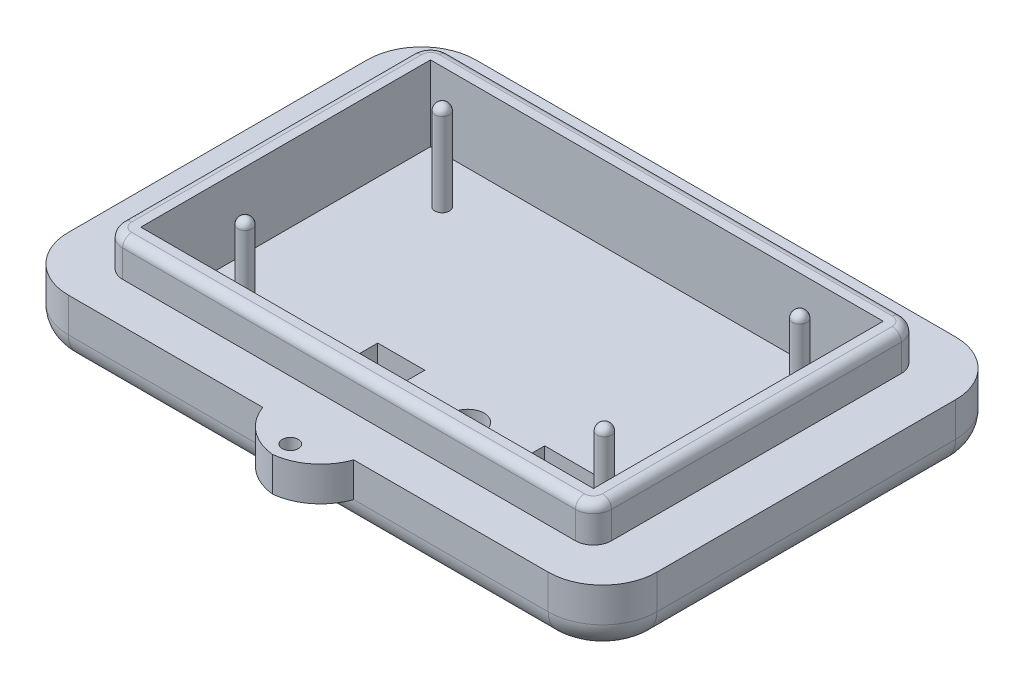
from build123d import *

# Parameters (mm, degrees)
SKETCH1_W                       = 82.55
SKETCH1_H                       = 57.15
BOSS_EXTRUDE1_DEPTH             = 8.636
FILLET2_R                       = 7.62
FILLET3_R                       = 3.81
SKETCH2_W                       = 63.5
SKETCH2_H                       = 40.64
CUT_EXTRUDE1_DEPTH              = 5.461
SKETCH7_W                       = 68.58
SKETCH7_H                       = 45.72
BOSS_EXTRUDE3_DEPTH             = 5.08
SKETCH8_W                       = 63.5
SKETCH8_H                       = 40.64
CUT_EXTRUDE3_DEPTH              = 5.08
SKETCH5_R                       = 1.016
BOSS_EXTRUDE4_DEPTH             = 12.7
SKETCH4_R                       = 2.25
SKETCH4_W                       = 12.6
SKETCH4_H                       = 5
SKETCH4_W_2                     = 6.604
SKETCH4_H_2                     = 6.604
CUT_EXTRUDE2_DEPTH              = 7.366
FILLET7_R                       = 1.016
FILLET8_R                       = 2.54
SKETCH9_W                       = 12.753817634
SKETCH9_H                       = 4.826
BOSS_EXTRUDE5_DEPTH             = 5.08
FILLET10_R                      = 7.62
FILLET11_R                      = 1.27
FILLET12_R                      = 1.016
F_4_40_TAPPED_HOLE2_D           = 2.2606
F_4_40_TAPPED_HOLE2_DEPTH       = 7.62
F_4_40_TAPPED_HOLE2_CSINK_D     = 4.1148
F_4_40_TAPPED_HOLE2_CSINK_ANGLE = 100
F_4_40_TAPPED_HOLE2_TIP         = 0.679152758


with BuildPart() as part:
    # Sketch1 → Boss-Extrude1 (new body)
    with BuildSketch(Plane(origin=(0, 0, 0), x_dir=(1, 0, 0), z_dir=(0, 1, 0))):
        with Locations((41.275, 28.575)):
            Rectangle(SKETCH1_W, SKETCH1_H)
    extrude(amount=BOSS_EXTRUDE1_DEPTH)

    # Fillet2
    fillet2_edges = [part.edges().sort_by_distance(p)[0] for p in [
        (0, 4.318, -57.15),
        (82.55, 4.318, -57.15),
        (82.55, 4.318, 0),
        (0, 4.318, 0),
    ]]
    fillet(fillet2_edges, radius=FILLET2_R)

    # Fillet3
    fillet3_edges = [part.edges().sort_by_distance(p)[0] for p in [
        (41.275, 0, -57.15),
        (0, 0, -28.575),
        (82.55, 0, -28.575),
        (41.275, 0, 0),
        (2.231846327, 0, -54.918153673),
        (2.231846327, 0, -2.231846327),
        (80.318153673, 0, -2.231846327),
        (80.318153673, 0, -54.918153673),
    ]]
    fillet(fillet3_edges, radius=FILLET3_R)

    # Sketch2 → Cut-Extrude1 (cut)
    with BuildSketch(Plane(origin=(0, 8.636, 0), x_dir=(1, 0, 0), z_dir=(0, 1, 0))):
        with Locations((41.275, 28.575)):
            Rectangle(SKETCH2_W, SKETCH2_H)
    extrude(amount=-CUT_EXTRUDE1_DEPTH, mode=Mode.SUBTRACT)

    # Sketch7 → Boss-Extrude3 (add)
    with BuildSketch(Plane(origin=(0, 8.636, 0), x_dir=(1, 0, 0), z_dir=(0, 1, 0))):
        with Locations((41.275, 28.575)):
            Rectangle(SKETCH7_W, SKETCH7_H)
    extrude(amount=BOSS_EXTRUDE3_DEPTH)

    # Sketch8 → Cut-Extrude3 (cut)
    with BuildSketch(Plane(origin=(0, 13.716, 0), x_dir=(1, 0, 0), z_dir=(0, 1, 0))):
        with Locations((41.275, 28.575)):
            Rectangle(SKETCH8_W, SKETCH8_H)
    extrude(amount=-CUT_EXTRUDE3_DEPTH, mode=Mode.SUBTRACT)

    # Sketch5 → Boss-Extrude4 (add)
    with BuildSketch(Plane(origin=(0, 3.175, 0), x_dir=(1, 0, 0), z_dir=(0, 1, 0))):
        with Locations(Location((17.665, 42.392, 0), (0, 0, 90))):
            Circle(SKETCH5_R)
        with Locations(Location((17.665, 14.732, 0), (0, 0, 90))):
            Circle(SKETCH5_R)
        with Locations(Location((67.945, 42.259, 0), (0, 0, 90))):
            Circle(SKETCH5_R)
        with Locations(Location((67.945, 14.859, 0), (0, 0, 90))):
            Circle(SKETCH5_R)
    extrude(amount=BOSS_EXTRUDE4_DEPTH)

    # Sketch4 → Cut-Extrude2 (cut)
    with BuildSketch(Plane(origin=(0, 3.175, 0), x_dir=(1, 0, 0), z_dir=(0, 1, 0))):
        with Locations(Location((45.641, 18.034, 0), (0, 0, 270))):
            Circle(SKETCH4_R)
        with Locations((60.171, 18.059)):
            Rectangle(SKETCH4_W, SKETCH4_H)
        with Locations((32.983, 18.034)):
            Rectangle(SKETCH4_W_2, SKETCH4_H_2)
    extrude(amount=-CUT_EXTRUDE2_DEPTH, mode=Mode.SUBTRACT)

    # Fillet7
    fillet7_edges = [part.edges().sort_by_distance(p)[0] for p in [
        (17.665, 15.875, -41.376),
        (17.665, 15.875, -13.716),
        (67.945, 15.875, -41.243),
    ]]
    fillet(fillet7_edges, radius=FILLET7_R)

    # Fillet8
    fillet8_edges = [part.edges().sort_by_distance(p)[0] for p in [
        (75.565, 11.176, -51.435),
        (6.985, 11.176, -51.435),
        (6.985, 11.176, -5.715),
        (75.565, 11.176, -5.715),
    ]]
    fillet(fillet8_edges, radius=FILLET8_R)

    # Sketch9 → Boss-Extrude5 (add)
    with BuildSketch(Plane.XY):
        with Locations((41.275, 6.223)):
            Rectangle(SKETCH9_W, SKETCH9_H)
    extrude(amount=BOSS_EXTRUDE5_DEPTH)

    # Fillet10
    # the kernel refuses this fillet: 7.62 mm, written as the material it takes off along each edge
    with BuildSketch(Plane(origin=(47.651908817, -14.150512242, 5.08), x_dir=(0, 0, -1), z_dir=(0, 1, 0)), Plane(origin=(34.898091183, 26.596512242, 5.08), x_dir=(0, 0, -1), z_dir=(0, -1, 0))) as fillet10_piece_1:
        with BuildLine():
            CenterArc((7.62, 7.184204897), FILLET10_R, 180, 70.528779366)
            Line((0, 7.184204897), (-0.1524, 7.184204897))
            Line((-0.1524, 7.184204897), (-0.1524, 0))
            Line((-0.1524, 0), (0, -0.1524))
            ThreePointArc((0, -0.1524), (2.54, -0.1524), (5.0292, -0.143684098))
            Line((5.0292, -0.143684098), (5.08, 0))
        make_face()
    extrude(amount=40.747024484, mode=Mode.SUBTRACT)

    # Fillet11
    fillet11_edges = [part.edges().sort_by_distance(p)[0] for p in [
        (41.275, 13.716, -51.435),
        (75.565, 13.716, -28.575),
        (6.985, 13.716, -28.575),
        (41.275, 13.716, -5.715),
        (7.728948776, 13.716, -50.691051224),
        (7.728948776, 13.716, -6.458948776),
        (74.821051224, 13.716, -6.458948776),
        (74.821051224, 13.716, -50.691051224),
    ]]
    fillet(fillet11_edges, radius=FILLET11_R)

    # Fillet12
    fillet12_edges = [part.edges().sort_by_distance(p)[0] for p in [
        (67.945, 15.875, -13.843),
    ]]
    fillet(fillet12_edges, radius=FILLET12_R)

    # #4-40 Tapped Hole2
    with Locations(Plane(origin=(0, 3.81, 0), x_dir=(-1, 0, 0), z_dir=(0, -1, 0))):
        with Locations((-41.275, -2.518557543)):
            CounterSinkHole(F_4_40_TAPPED_HOLE2_D / 2, F_4_40_TAPPED_HOLE2_CSINK_D / 2, depth=F_4_40_TAPPED_HOLE2_DEPTH, counter_sink_angle=F_4_40_TAPPED_HOLE2_CSINK_ANGLE)
            with Locations((0, 0, -(F_4_40_TAPPED_HOLE2_DEPTH + F_4_40_TAPPED_HOLE2_TIP / 2))):  # 118° drill point
                Cone(0, F_4_40_TAPPED_HOLE2_D / 2, F_4_40_TAPPED_HOLE2_TIP, mode=Mode.SUBTRACT)


solid = part.part
